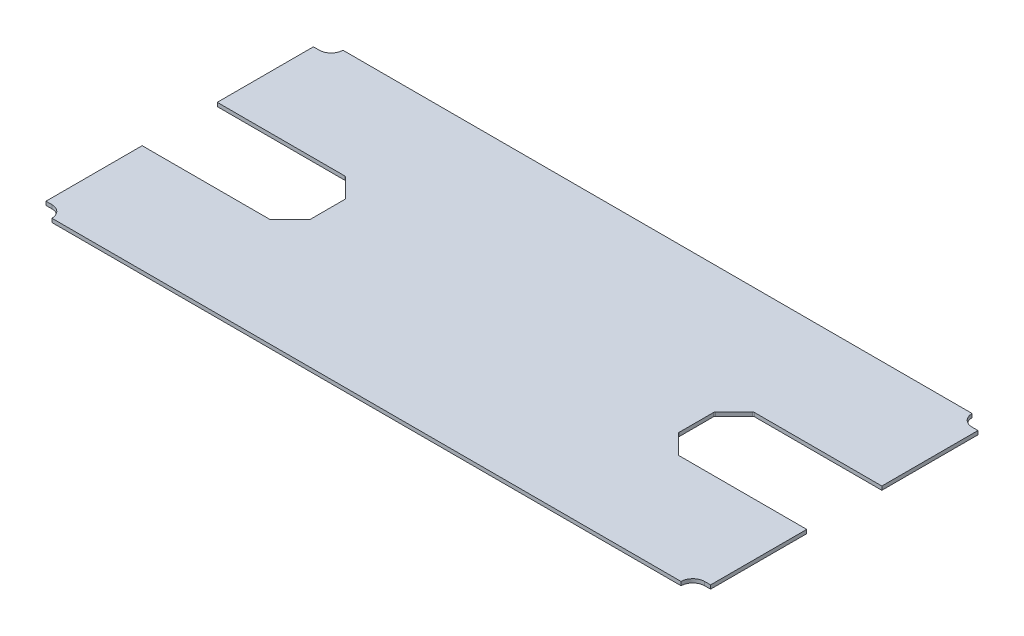
from build123d import *

# Parameters (mm, degrees)
BOSS_EXTRUDE1_DEPTH = 9.525
CHAMFER1_SIZE       = 50
FILLET2_R           = 5


with BuildPart() as part:
    # Sketch1 → Boss-Extrude1 (new body)
    with BuildSketch(Plane(origin=(0, 0, 0), x_dir=(1, 0, 0), z_dir=(0, 1, 0))):
        with BuildLine():
            Line((-845, 340), (-845, 95.5))
            Line((-845, 95.5), (-469, 95.5))
            Line((-469, 95.5), (-469, -95.5))
            Line((-469, -95.5), (-845, -95.5))
            Line((-845, -95.5), (-845, -340))
            Line((-845, -340), (-830, -340))
            ThreePointArc((-830, -340), (-808.786796564, -348.786796564), (-800, -370))
            Line((-800, -370), (800, -370))
            ThreePointArc((800, -370), (808.786796564, -348.786796564), (830, -340))
            Line((830, -340), (845, -340))
            Line((845, -340), (845, -95.5))
            Line((845, -95.5), (469, -95.5))
            Line((469, -95.5), (469, 95.5))
            Line((469, 95.5), (845, 95.5))
            Line((845, 95.5), (845, 340))
            Line((845, 340), (830, 340))
            ThreePointArc((830, 340), (808.786796564, 348.786796564), (800, 370))
            Line((800, 370), (-800, 370))
            ThreePointArc((-800, 370), (-808.786796564, 348.786796564), (-830, 340))
            Line((-830, 340), (-845, 340))
        make_face()
    extrude(amount=BOSS_EXTRUDE1_DEPTH)

    # Chamfer1
    chamfer1_edges = [part.edges().sort_by_distance(p)[0] for p in [
        (469, 4.7625, 95.5),
        (469, 4.7625, -95.5),
        (-469, 4.7625, 95.5),
        (-469, 4.7625, -95.5),
    ]]
    chamfer(chamfer1_edges, length=CHAMFER1_SIZE)

    # Fillet2
    fillet2_edges = [part.edges().sort_by_distance(p)[0] for p in [
        (469, 4.7625, -45.5),
        (469, 4.7625, 45.5),
        (519, 4.7625, 95.5),
        (519, 4.7625, -95.5),
        (-519, 4.7625, 95.5),
        (-469, 4.7625, 45.5),
        (-469, 4.7625, -45.5),
        (-519, 4.7625, -95.5),
    ]]
    fillet(fillet2_edges, radius=FILLET2_R)


solid = part.part
